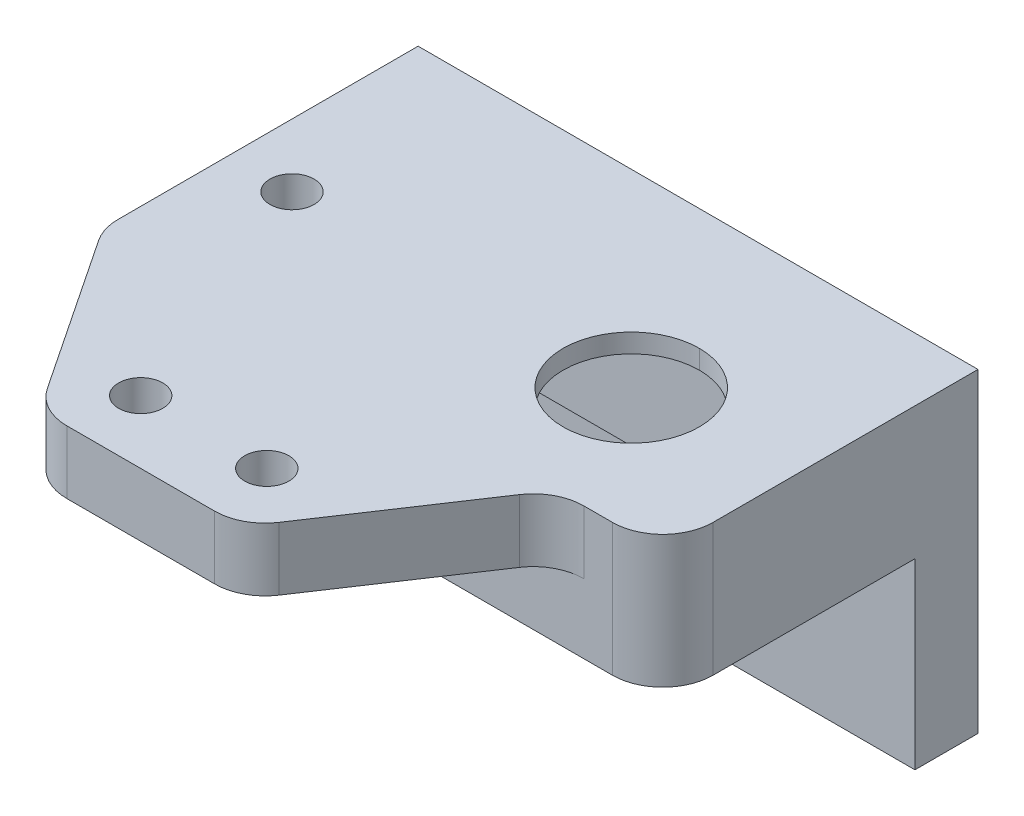
from build123d import *

# Parameters (mm, degrees)
SKETCH1_R           = 1.75
SKETCH1_W           = 7.2
SKETCH1_H           = 5.4
BOSS_EXTRUDE1_DEPTH = 5
FILLET5_RADIUS      = 10
FILLET5_LENGTH      = 5
FILLET2_R           = 5.4
FILLET6_R           = 5.4
SKETCH3_W           = 35
SKETCH3_H           = 20
SKETCH3_W_2         = 23
SKETCH3_H_2         = 13
BOSS_EXTRUDE4_DEPTH = 5.5
SKETCH5_W           = 23
SKETCH5_H           = 13
CUT_EXTRUDE1_DEPTH  = 3.5
CUT_EXTRUDE2_DEPTH  = 76.201396264
SKETCH9_R           = 1
CUT_EXTRUDE4_DEPTH  = 7
SKETCH10_W          = 36
SKETCH10_H          = 5
CUT_EXTRUDE5_DEPTH  = 10
FILLET10_R          = 4
SKETCH11_W          = 44.4
SKETCH11_H          = 25
BOSS_EXTRUDE5_DEPTH = 5
SKETCH12_W          = 1.180339887
SKETCH12_H          = 5
BOSS_EXTRUDE6_DEPTH = 44.4
SKETCH13_R          = 0.75
CUT_EXTRUDE6_DEPTH  = 5


with BuildPart() as part:
    # Sketch1 → Boss-Extrude1 (new body)
    # profile 1 of 4: a face of its own
    with BuildSketch(Plane(origin=(0, 0, 0), x_dir=(1, 0, 0), z_dir=(0, 1, 0))):
        with BuildLine():
            Line((3.25, 25), (0, 25))
            Line((0, 25), (0, 15))
            Line((0, 15), (10, 0))
            Line((10, 0), (26, 0))
            Line((26, 0), (36, 15))
            Line((36, 15), (60, 15))
            Line((60, 15), (60, 25))
            Line((60, 25), (44.5, 25))
            Line((44.5, 25), (44.5, 19.6))
            Line((44.5, 19.6), (37.3, 19.6))
            Line((37.3, 19.6), (26.5, 19.6))
            Line((26.5, 19.6), (26.5, 25))
            Line((26.5, 25), (6.75, 25))
            ThreePointArc((6.75, 25), (5, 23.25), (3.25, 25))
        make_face()
        with Locations(Location((13, 5, 0), (0, 0, 270))):
            Circle(SKETCH1_R, mode=Mode.SUBTRACT)
        with Locations(Location((23, 5, 0), (0, 0, 270))):
            Circle(SKETCH1_R, mode=Mode.SUBTRACT)
    # profile 2 of 4: a face of its own
    with BuildSketch(Plane(origin=(0, 0, 0), x_dir=(1, 0, 0), z_dir=(0, 1, 0))):
        with BuildLine():
            Line((10, 45), (0, 33.819660113))
            Line((0, 33.819660113), (0, 25))
            Line((0, 25), (3.25, 25))
            ThreePointArc((3.25, 25), (5, 26.75), (6.75, 25))
            Line((6.75, 25), (26.5, 25))
            Line((26.5, 25), (26.5, 30.4))
            Line((26.5, 30.4), (37.3, 30.4))
            Line((37.3, 30.4), (44.5, 30.4))
            Line((44.5, 30.4), (44.5, 25))
            Line((44.5, 25), (60, 25))
            Line((60, 25), (60, 35))
            Line((60, 35), (36, 35))
            Line((36, 35), (26, 45))
            Line((26, 45), (10, 45))
        make_face()
    # profile 3 of 4: a face of its own
    with BuildSketch(Plane(origin=(0, 0, 0), x_dir=(1, 0, 0), z_dir=(0, 1, 0))):
        with Locations((40.9, 27.7)):
            Rectangle(SKETCH1_W, SKETCH1_H)
    # profile 4 of 4: a face of its own
    with BuildSketch(Plane(origin=(0, 0, 0), x_dir=(1, 0, 0), z_dir=(0, 1, 0))):
        with Locations((40.9, 22.3)):
            Rectangle(SKETCH1_W, SKETCH1_H)
    extrude(amount=BOSS_EXTRUDE1_DEPTH)

    # Fillet5: full round fillet: the end face becomes a half cylinder, R = half its width
    fillet5_face = Plane((60, 2.5, -25), x_dir=(0, -1, 0), z_dir=(1, 0, 0))  # on the end face: x along it, z out of the body
    fillet5_slab = fillet5_face.offset(-FILLET5_RADIUS / 2) * Box(FILLET5_LENGTH, 2 * FILLET5_RADIUS, FILLET5_RADIUS, mode=Mode.PRIVATE)  # the body's end, R deep
    fillet5_round = Plane((50, 2.5, -25), x_dir=(1, 0, 0), z_dir=(0, -1, 0)) * Cylinder(FILLET5_RADIUS, FILLET5_LENGTH, mode=Mode.PRIVATE)  # its axis R under the face
    add(fillet5_slab - fillet5_round, mode=Mode.SUBTRACT)

    # Fillet2
    fillet2_edges = [part.edges().sort_by_distance(p)[0] for p in [
        (26.5, 2.5, -30.4),
        (26.5, 2.5, -19.6),
    ]]
    fillet(fillet2_edges, radius=FILLET2_R - 0.0001)  # a hair under: the kernel refuses the full size

    # Fillet6
    fillet6_edges = [part.edges().sort_by_distance(p)[0] for p in [
        (37.3, 2.5, -19.6),
        (37.3, 2.5, -30.4),
    ]]
    fillet(fillet6_edges, radius=FILLET6_R - 0.0001)  # a hair under: the kernel refuses the full size

    # Sketch3 → Boss-Extrude4 (add)
    with BuildSketch(Plane.XZ):
        with Locations((26.9, -25)):
            Rectangle(SKETCH3_W, SKETCH3_H)
        with Locations((26.9, -25)):
            Rectangle(SKETCH3_W_2, SKETCH3_H_2, mode=Mode.SUBTRACT)
    extrude(amount=BOSS_EXTRUDE4_DEPTH)

    # Sketch5 → Cut-Extrude1 (cut)
    with BuildSketch(Plane.XZ):
        with Locations((26.9, -25)):
            Rectangle(SKETCH5_W, SKETCH5_H)
    extrude(amount=-CUT_EXTRUDE1_DEPTH, mode=Mode.SUBTRACT)

    # Sketch6 → Cut-Extrude2 (cut, through all)
    with BuildSketch(Plane.XZ):
        with BuildLine():
            Line((44.4, -15), (44.4, -35))
            Line((44.4, -35), (50, -35))
            ThreePointArc((50, -35), (60, -25), (50, -15))
            Line((50, -15), (44.4, -15))
        make_face()
    extrude(amount=-CUT_EXTRUDE2_DEPTH, mode=Mode.SUBTRACT)

    # Sketch9 → Cut-Extrude4 (cut)
    with BuildSketch(Plane.XZ.offset(5.5)):
        with Locations(Location((13.1, -25, 0), (0, 0, 270))):
            Circle(SKETCH9_R)
        with Locations(Location((40.7, -25, 0), (0, 0, 270))):
            Circle(SKETCH9_R)
    extrude(amount=-CUT_EXTRUDE4_DEPTH, mode=Mode.SUBTRACT)

    # Sketch10 → Cut-Extrude5 (cut)
    with BuildSketch(Plane(origin=(0, 0, -45), x_dir=(-1, 0, 0), z_dir=(0, 0, -1))):
        with Locations((-18, 2.5)):
            Rectangle(SKETCH10_W, SKETCH10_H)
    extrude(amount=-CUT_EXTRUDE5_DEPTH, mode=Mode.SUBTRACT)

    # Fillet10
    fillet10_edges = [part.edges().sort_by_distance(p)[0] for p in [
        (36, 2.5, -15),
        (26, 2.5, 0),
        (10, 2.5, 0),
        (0, 2.5, -15),
        (44.4, -0.25, -15),
        (9.4, -2.75, -15),
    ]]
    fillet(fillet10_edges, radius=FILLET10_R)

    # Sketch11 → Boss-Extrude5 (add)
    with BuildSketch(Plane(origin=(0, 0, -35), x_dir=(-1, 0, 0), z_dir=(0, 0, -1))):
        with Locations((-22.2, -7.5)):
            Rectangle(SKETCH11_W, SKETCH11_H)
    extrude(amount=BOSS_EXTRUDE5_DEPTH)

    # Sketch12 → Boss-Extrude6 (add)
    with BuildSketch(Plane.ZY):
        with Locations((-34.409830056, 2.5)):
            Rectangle(SKETCH12_W, SKETCH12_H)
    extrude(amount=-BOSS_EXTRUDE6_DEPTH)

    # Sketch13 → Cut-Extrude6 (cut)
    with BuildSketch(Plane(origin=(0, 0, -40), x_dir=(-1, 0, 0), z_dir=(0, 0, -1))):
        with Locations((-26, 0.5)):
            Circle(SKETCH13_R)
        with Locations((-10, 0.5)):
            Circle(SKETCH13_R)
        with Locations((-10, -15.5)):
            Circle(SKETCH13_R)
        with Locations((-26, -15.5)):
            Circle(SKETCH13_R)
    extrude(amount=-CUT_EXTRUDE6_DEPTH, mode=Mode.SUBTRACT)


solid = part.part
